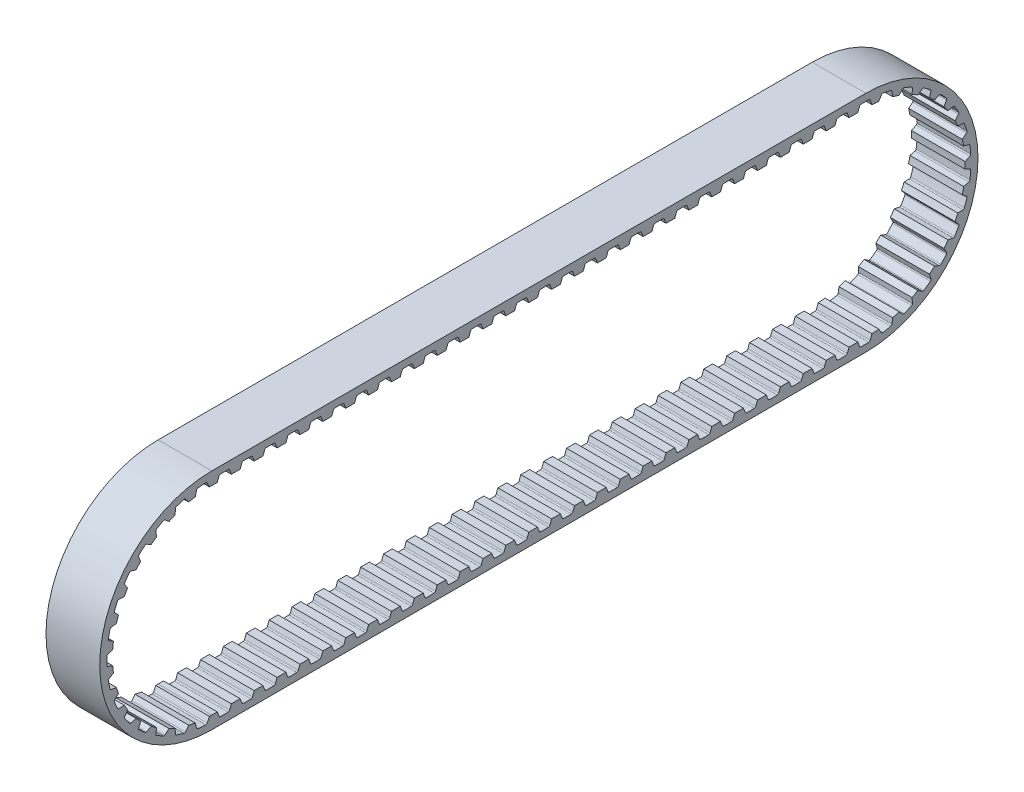
from build123d import *

# Parameters (mm, degrees)
SKETCH_2_W            = 4.8
SKETCH_2_H            = 1.14
CUT_EXTRUDE_1_DEPTH   = 70.216581626
PATTERN_START         = -2.4
PATTERN_CURVE_1_DEPTH = 4.8


with BuildPart() as part:
    # 扫描1: sweep along a path in 草图1
    with BuildLine(Plane(origin=(0, 0, 0), x_dir=(0, 0, -1), z_dir=(1, 0, 0))) as sweep_1_path:
        Line((0, 10.016), (58.43, 10.016))
        ThreePointArc((58.43, 10.016), (68.446, 0), (58.43, -10.016))
        Line((58.43, -10.016), (0, -10.016))
        ThreePointArc((0, -10.016), (-10.016, 0), (0, 10.016))
    # 草图2 → 扫描1 (sweep)
    with BuildSketch(Plane.XY):
        with Locations((0, 9.446)):
            Rectangle(SKETCH_2_W, SKETCH_2_H)
    sweep(path=sweep_1_path.line)

    # 草图3 → 切除-拉伸1 (cut, symmetric)
    with BuildSketch(Plane(origin=(0, 0, 0), x_dir=(0, 0, -1), z_dir=(1, 0, 0))):
        with BuildLine():
            Line((-9.293707032, 0.475732932), (-7.602, 1.091463937))
            Line((-7.602, 1.091463937), (-7.602, -1.091463937))
            Line((-7.602, -1.091463937), (-9.293707032, -0.475732932))
            ThreePointArc((-9.293707032, -0.475732932), (-9.354290321, -0.430158511), (-9.379149531, -0.358538803))
            ThreePointArc((-9.379149531, -0.358538803), (-9.386, 0), (-9.379149531, 0.358538803))
            ThreePointArc((-9.379149531, 0.358538803), (-9.354290321, 0.430158511), (-9.293707032, 0.475732932))
        make_face()
    extrude(amount=CUT_EXTRUDE_1_DEPTH, both=True, mode=Mode.SUBTRACT)

    # 曲线阵列1: read off the stored shape, not the designer's step
    # 曲线阵列1 outline → 曲线阵列1 (cut)
    with BuildSketch(Plane.YZ.offset(PATTERN_START)):
        with BuildLine():
            ThreePointArc((2.408909246, 8.98868558), (2.377013143, 9.057460587), (2.312176357, 9.096748677))
            ThreePointArc((2.312176357, 9.096748677), (1.962999192, 9.178432882), (1.610956596, 9.24671914))
            ThreePointArc((1.610956596, 9.24671914), (1.535721641, 9.237388311), (1.478484616, 9.187676281))
            Line((1.478484616, 9.187676281), (1.229559122, 8.790424357))
            ThreePointArc((1.229559122, 8.790424357), (1.856337186, 8.6797113), (2.47356987, 8.524366728))
            Line((2.47356987, 8.524366728), (2.408909246, 8.98868558))
        make_face()
        with BuildLine():
            Line((-2.408909246, 8.98868558), (-2.47356987, 8.524366728))
            ThreePointArc((-2.47356987, 8.524366728), (-1.856337186, 8.6797113), (-1.229559122, 8.790424357))
            Line((-1.229559122, 8.790424357), (-1.478484616, 9.187676281))
            ThreePointArc((-1.478484616, 9.187676281), (-1.535721641, 9.237388311), (-1.610956596, 9.24671914))
            ThreePointArc((-1.610956596, 9.24671914), (-1.962999192, 9.178432882), (-2.312176357, 9.096748677))
            ThreePointArc((-2.312176357, 9.096748677), (-2.377013143, 9.057460587), (-2.408909246, 8.98868558))
        make_face()
        with BuildLine():
            Line((-4.235541696, 8.286102748), (-4.201664183, 7.818528896))
            ThreePointArc((-4.201664183, 7.818528896), (-3.630570268, 8.099526871), (-3.040807775, 8.338876668))
            Line((-3.040807775, 8.338876668), (-3.367310135, 8.675282973))
            ThreePointArc((-3.367310135, 8.675282973), (-3.433678222, 8.711925024), (-3.509200851, 8.705314778))
            ThreePointArc((-3.509200851, 8.705314778), (-3.839176716, 8.564912034), (-4.163548456, 8.41200691))
            ThreePointArc((-4.163548456, 8.41200691), (-4.218734648, 8.360027615), (-4.235541696, 8.286102748))
        make_face()
        with BuildLine():
            Line((-5.874839993, 7.217033135), (-5.743922715, 6.766884649))
            ThreePointArc((-5.743922715, 6.766884649), (-5.244226532, 7.161107742), (-4.717564269, 7.518508055))
            Line((-4.717564269, 7.518508055), (-5.107202592, 7.779189797))
            ThreePointArc((-5.107202592, 7.779189797), (-5.179766341, 7.801141225), (-5.252236347, 7.778882269))
            ThreePointArc((-5.252236347, 7.778882269), (-5.545550949, 7.572572923), (-5.830770596, 7.355209735))
            ThreePointArc((-5.830770596, 7.355209735), (-5.87386536, 7.292838234), (-5.874839993, 7.217033135))
        make_face()
        with BuildLine():
            Line((-7.254299465, 5.828760716), (-7.032132774, 5.415947254))
            ThreePointArc((-7.032132774, 5.415947254), (-6.62593543, 5.905959336), (-6.18566719, 6.365602675))
            Line((-6.18566719, 6.365602675), (-6.621208128, 6.539030137))
            ThreePointArc((-6.621208128, 6.539030137), (-6.696758111, 6.545320051), (-6.762970211, 6.508396878))
            ThreePointArc((-6.762970211, 6.508396878), (-7.006650512, 6.245305805), (-7.240103062, 5.97309833))
            ThreePointArc((-7.240103062, 5.97309833), (-7.269200354, 5.903093255), (-7.254299465, 5.828760716))
        make_face()
        with BuildLine():
            Line((-8.312907876, 4.182687517), (-8.009318002, 3.825467442))
            ThreePointArc((-8.009318002, 3.825467442), (-7.714585237, 4.389595725), (-7.380183683, 4.931152483))
            Line((-7.380183683, 4.931152483), (-7.842363656, 5.009655127))
            ThreePointArc((-7.842363656, 5.009655127), (-7.917558365, 5.000005329), (-7.974584059, 4.950051018))
            ThreePointArc((-7.974584059, 4.950051018), (-8.157852302, 4.641814497), (-8.329212359, 4.326802223))
            ThreePointArc((-8.329212359, 4.326802223), (-8.343025234, 4.252259837), (-8.312907876, 4.182687517))
        make_face()
        with BuildLine():
            Line((-9.003843939, 2.351617856), (-8.632258386, 2.065790688))
            ThreePointArc((-8.632258386, 2.065790688), (-8.462025961, 2.679084291), (-8.248281369, 3.278601907))
            Line((-8.248281369, 3.278601907), (-8.716658579, 3.258707632))
            ThreePointArc((-8.716658579, 3.258707632), (-8.788172221, 3.233544924), (-8.833489314, 3.172768908))
            ThreePointArc((-8.833489314, 3.172768908), (-8.94823971, 2.833019959), (-9.049928177, 2.489135592))
            ThreePointArc((-9.049928177, 2.489135592), (-9.047845702, 2.413352836), (-9.003843939, 2.351617856))
        make_face()
        with BuildLine():
            Line((-9.296548181, 0.416538279), (-8.873401839, 0.214745892))
            ThreePointArc((-8.873401839, 0.214745892), (-8.83519898, 0.850079398), (-8.751565079, 1.481041753))
            Line((-8.751565079, 1.481041753), (-9.205423628, 1.363630464))
            ThreePointArc((-9.205423628, 1.363630464), (-9.27009322, 1.32406777), (-9.301697377, 1.255158118))
            ThreePointArc((-9.301697377, 1.255158118), (-9.342854622, 0.898923528), (-9.370373909, 0.54137676))
            ThreePointArc((-9.370373909, 0.54137676), (-9.352488192, 0.467705436), (-9.296548181, 0.416538279))
        make_face()
        with BuildLine():
            Line((-9.293707032, -1.589068101), (-8.876, -1.741101027))
            Line((-8.876, -1.741101027), (-8.876, -0.48556931))
            Line((-8.876, -0.48556931), (-9.293707032, -0.637602236))
            ThreePointArc((-9.293707032, -0.637602236), (-9.354290321, -0.683176657), (-9.379149531, -0.754796365))
            ThreePointArc((-9.379149531, -0.754796365), (-9.386, -1.113335168), (-9.379149531, -1.471873971))
            ThreePointArc((-9.379149531, -1.471873971), (-9.354290321, -1.543493679), (-9.293707032, -1.589068101))
        make_face()
        with BuildLine():
            Line((-9.293707032, -3.632825543), (-8.876, -3.784858469))
            Line((-8.876, -3.784858469), (-8.876, -2.529326752))
            Line((-8.876, -2.529326752), (-9.293707032, -2.681359678))
            ThreePointArc((-9.293707032, -2.681359678), (-9.354290321, -2.7269341), (-9.379149531, -2.798553808))
            ThreePointArc((-9.379149531, -2.798553808), (-9.386, -3.157092611), (-9.379149531, -3.515631414))
            ThreePointArc((-9.379149531, -3.515631414), (-9.354290321, -3.587251122), (-9.293707032, -3.632825543))
        make_face()
        with BuildLine():
            Line((-9.293707032, -5.676582985), (-8.876, -5.828615911))
            Line((-8.876, -5.828615911), (-8.876, -4.573084195))
            Line((-8.876, -4.573084195), (-9.293707032, -4.725117121))
            ThreePointArc((-9.293707032, -4.725117121), (-9.354290321, -4.770691542), (-9.379149531, -4.84231125))
            ThreePointArc((-9.379149531, -4.84231125), (-9.386, -5.200850053), (-9.379149531, -5.559388856))
            ThreePointArc((-9.379149531, -5.559388856), (-9.354290321, -5.631008564), (-9.293707032, -5.676582985))
        make_face()
        with BuildLine():
            Line((-9.293707032, -7.720340428), (-8.876, -7.872373354))
            Line((-8.876, -7.872373354), (-8.876, -6.616841637))
            Line((-8.876, -6.616841637), (-9.293707032, -6.768874563))
            ThreePointArc((-9.293707032, -6.768874563), (-9.354290321, -6.814448984), (-9.379149531, -6.886068692))
            ThreePointArc((-9.379149531, -6.886068692), (-9.386, -7.244607495), (-9.379149531, -7.603146298))
            ThreePointArc((-9.379149531, -7.603146298), (-9.354290321, -7.674766006), (-9.293707032, -7.720340428))
        make_face()
        with BuildLine():
            Line((-9.293707032, -9.76409787), (-8.876, -9.916130796))
            Line((-8.876, -9.916130796), (-8.876, -8.660599079))
            Line((-8.876, -8.660599079), (-9.293707032, -8.812632005))
            ThreePointArc((-9.293707032, -8.812632005), (-9.354290321, -8.858206427), (-9.379149531, -8.929826135))
            ThreePointArc((-9.379149531, -8.929826135), (-9.386, -9.288364938), (-9.379149531, -9.646903741))
            ThreePointArc((-9.379149531, -9.646903741), (-9.354290321, -9.718523449), (-9.293707032, -9.76409787))
        make_face()
        with BuildLine():
            Line((-9.293707032, -11.807855312), (-8.876, -11.959888238))
            Line((-8.876, -11.959888238), (-8.876, -10.704356522))
            Line((-8.876, -10.704356522), (-9.293707032, -10.856389448))
            ThreePointArc((-9.293707032, -10.856389448), (-9.354290321, -10.901963869), (-9.379149531, -10.973583577))
            ThreePointArc((-9.379149531, -10.973583577), (-9.386, -11.33212238), (-9.379149531, -11.690661183))
            ThreePointArc((-9.379149531, -11.690661183), (-9.354290321, -11.762280891), (-9.293707032, -11.807855312))
        make_face()
        with BuildLine():
            Line((-9.293707032, -13.851612754), (-8.876, -14.003645681))
            Line((-8.876, -14.003645681), (-8.876, -12.748113964))
            Line((-8.876, -12.748113964), (-9.293707032, -12.90014689))
            ThreePointArc((-9.293707032, -12.90014689), (-9.354290321, -12.945721311), (-9.379149531, -13.017341019))
            ThreePointArc((-9.379149531, -13.017341019), (-9.386, -13.375879822), (-9.379149531, -13.734418625))
            ThreePointArc((-9.379149531, -13.734418625), (-9.354290321, -13.806038333), (-9.293707032, -13.851612754))
        make_face()
        with BuildLine():
            Line((-9.293707032, -15.895370197), (-8.876, -16.047403123))
            Line((-8.876, -16.047403123), (-8.876, -14.791871406))
            Line((-8.876, -14.791871406), (-9.293707032, -14.943904332))
            ThreePointArc((-9.293707032, -14.943904332), (-9.354290321, -14.989478754), (-9.379149531, -15.061098462))
            ThreePointArc((-9.379149531, -15.061098462), (-9.386, -15.419637265), (-9.379149531, -15.778176067))
            ThreePointArc((-9.379149531, -15.778176067), (-9.354290322, -15.849795775), (-9.293707032, -15.895370197))
        make_face()
        with BuildLine():
            Line((-9.293707032, -17.939127639), (-8.876, -18.091160565))
            Line((-8.876, -18.091160565), (-8.876, -16.835628848))
            Line((-8.876, -16.835628848), (-9.293707032, -16.987661775))
            ThreePointArc((-9.293707032, -16.987661775), (-9.354290321, -17.033236196), (-9.379149531, -17.104855904))
            ThreePointArc((-9.379149531, -17.104855904), (-9.386, -17.463394707), (-9.379149531, -17.82193351))
            ThreePointArc((-9.379149531, -17.82193351), (-9.354290321, -17.893553218), (-9.293707032, -17.939127639))
        make_face()
        with BuildLine():
            Line((-9.293707032, -19.982885081), (-8.876, -20.134918007))
            Line((-8.876, -20.134918007), (-8.876, -18.879386291))
            Line((-8.876, -18.879386291), (-9.293707032, -19.031419217))
            ThreePointArc((-9.293707032, -19.031419217), (-9.354290321, -19.076993638), (-9.379149531, -19.148613346))
            ThreePointArc((-9.379149531, -19.148613346), (-9.386, -19.507152149), (-9.379149531, -19.865690952))
            ThreePointArc((-9.379149531, -19.865690952), (-9.354290321, -19.93731066), (-9.293707032, -19.982885081))
        make_face()
        with BuildLine():
            Line((-9.293707032, -22.026642524), (-8.876, -22.17867545))
            Line((-8.876, -22.17867545), (-8.876, -20.923143733))
            Line((-8.876, -20.923143733), (-9.293707032, -21.075176659))
            ThreePointArc((-9.293707032, -21.075176659), (-9.354290321, -21.12075108), (-9.379149531, -21.192370788))
            ThreePointArc((-9.379149531, -21.192370788), (-9.386, -21.550909591), (-9.379149531, -21.909448394))
            ThreePointArc((-9.379149531, -21.909448394), (-9.354290321, -21.981068102), (-9.293707032, -22.026642524))
        make_face()
        with BuildLine():
            Line((-9.293707032, -24.070399966), (-8.876, -24.222432892))
            Line((-8.876, -24.222432892), (-8.876, -22.966901175))
            Line((-8.876, -22.966901175), (-9.293707032, -23.118934101))
            ThreePointArc((-9.293707032, -23.118934101), (-9.354290321, -23.164508523), (-9.379149531, -23.236128231))
            ThreePointArc((-9.379149531, -23.236128231), (-9.386, -23.594667034), (-9.379149531, -23.953205837))
            ThreePointArc((-9.379149531, -23.953205837), (-9.354290321, -24.024825545), (-9.293707032, -24.070399966))
        make_face()
        with BuildLine():
            Line((-9.293707032, -26.114157408), (-8.876, -26.266190334))
            Line((-8.876, -26.266190334), (-8.876, -25.010658618))
            Line((-8.876, -25.010658618), (-9.293707032, -25.162691544))
            ThreePointArc((-9.293707032, -25.162691544), (-9.354290321, -25.208265965), (-9.379149531, -25.279885673))
            ThreePointArc((-9.379149531, -25.279885673), (-9.386, -25.638424476), (-9.379149531, -25.996963279))
            ThreePointArc((-9.379149531, -25.996963279), (-9.354290321, -26.068582987), (-9.293707032, -26.114157408))
        make_face()
        with BuildLine():
            Line((-9.293707032, -28.157914851), (-8.876, -28.309947777))
            Line((-8.876, -28.309947777), (-8.876, -27.05441606))
            Line((-8.876, -27.05441606), (-9.293707032, -27.206448986))
            ThreePointArc((-9.293707032, -27.206448986), (-9.354290321, -27.252023407), (-9.379149531, -27.323643115))
            ThreePointArc((-9.379149531, -27.323643115), (-9.386, -27.682181918), (-9.379149531, -28.040720721))
            ThreePointArc((-9.379149531, -28.040720721), (-9.354290321, -28.112340429), (-9.293707032, -28.157914851))
        make_face()
        with BuildLine():
            Line((-9.293707032, -30.201672293), (-8.876, -30.353705219))
            Line((-8.876, -30.353705219), (-8.876, -29.098173502))
            Line((-8.876, -29.098173502), (-9.293707032, -29.250206428))
            ThreePointArc((-9.293707032, -29.250206428), (-9.354290321, -29.29578085), (-9.379149531, -29.367400558))
            ThreePointArc((-9.379149531, -29.367400558), (-9.386, -29.725939361), (-9.379149531, -30.084478164))
            ThreePointArc((-9.379149531, -30.084478164), (-9.354290321, -30.156097872), (-9.293707032, -30.201672293))
        make_face()
        with BuildLine():
            Line((-9.293707032, -32.245429735), (-8.876, -32.397462661))
            Line((-8.876, -32.397462661), (-8.876, -31.141930944))
            Line((-8.876, -31.141930944), (-9.293707032, -31.293963871))
            ThreePointArc((-9.293707032, -31.293963871), (-9.354290321, -31.339538292), (-9.379149531, -31.411158))
            ThreePointArc((-9.379149531, -31.411158), (-9.386, -31.769696803), (-9.379149531, -32.128235606))
            ThreePointArc((-9.379149531, -32.128235606), (-9.354290321, -32.199855314), (-9.293707032, -32.245429735))
        make_face()
        with BuildLine():
            Line((-9.293707032, -34.289187177), (-8.876, -34.441220104))
            Line((-8.876, -34.441220104), (-8.876, -33.185688387))
            Line((-8.876, -33.185688387), (-9.293707032, -33.337721313))
            ThreePointArc((-9.293707032, -33.337721313), (-9.354290321, -33.383295734), (-9.379149531, -33.454915442))
            ThreePointArc((-9.379149531, -33.454915442), (-9.386, -33.813454245), (-9.379149531, -34.171993048))
            ThreePointArc((-9.379149531, -34.171993048), (-9.354290321, -34.243612756), (-9.293707032, -34.289187177))
        make_face()
        with BuildLine():
            Line((-9.293707032, -36.33294462), (-8.876, -36.484977546))
            Line((-8.876, -36.484977546), (-8.876, -35.229445829))
            Line((-8.876, -35.229445829), (-9.293707032, -35.381478755))
            ThreePointArc((-9.293707032, -35.381478755), (-9.354290322, -35.427053177), (-9.379149531, -35.498672885))
            ThreePointArc((-9.379149531, -35.498672885), (-9.386, -35.857211687), (-9.379149531, -36.21575049))
            ThreePointArc((-9.379149531, -36.21575049), (-9.354290321, -36.287370198), (-9.293707032, -36.33294462))
        make_face()
        with BuildLine():
            Line((-9.293707032, -38.376702062), (-8.876, -38.528734988))
            Line((-8.876, -38.528734988), (-8.876, -37.273203271))
            Line((-8.876, -37.273203271), (-9.293707032, -37.425236197))
            ThreePointArc((-9.293707032, -37.425236197), (-9.354290321, -37.470810619), (-9.379149531, -37.542430327))
            ThreePointArc((-9.379149531, -37.542430327), (-9.386, -37.90096913), (-9.379149531, -38.259507933))
            ThreePointArc((-9.379149531, -38.259507933), (-9.354290321, -38.331127641), (-9.293707032, -38.376702062))
        make_face()
        with BuildLine():
            Line((-9.293707032, -40.420459504), (-8.876, -40.57249243))
            Line((-8.876, -40.57249243), (-8.876, -39.316960714))
            Line((-8.876, -39.316960714), (-9.293707032, -39.46899364))
            ThreePointArc((-9.293707032, -39.46899364), (-9.354290321, -39.514568061), (-9.379149531, -39.586187769))
            ThreePointArc((-9.379149531, -39.586187769), (-9.386, -39.944726572), (-9.379149531, -40.303265375))
            ThreePointArc((-9.379149531, -40.303265375), (-9.354290321, -40.374885083), (-9.293707032, -40.420459504))
        make_face()
        with BuildLine():
            Line((-9.293707032, -42.464216947), (-8.876, -42.616249873))
            Line((-8.876, -42.616249873), (-8.876, -41.360718156))
            Line((-8.876, -41.360718156), (-9.293707032, -41.512751082))
            ThreePointArc((-9.293707032, -41.512751082), (-9.354290321, -41.558325503), (-9.379149531, -41.629945211))
            ThreePointArc((-9.379149531, -41.629945211), (-9.386, -41.988484014), (-9.379149531, -42.347022817))
            ThreePointArc((-9.379149531, -42.347022817), (-9.354290321, -42.418642525), (-9.293707032, -42.464216947))
        make_face()
        with BuildLine():
            Line((-9.293707032, -44.507974389), (-8.876, -44.660007315))
            Line((-8.876, -44.660007315), (-8.876, -43.404475598))
            Line((-8.876, -43.404475598), (-9.293707032, -43.556508524))
            ThreePointArc((-9.293707032, -43.556508524), (-9.354290321, -43.602082946), (-9.379149531, -43.673702654))
            ThreePointArc((-9.379149531, -43.673702654), (-9.386, -44.032241457), (-9.379149531, -44.39078026))
            ThreePointArc((-9.379149531, -44.39078026), (-9.354290321, -44.462399968), (-9.293707032, -44.507974389))
        make_face()
        with BuildLine():
            Line((-9.293707032, -46.551731831), (-8.876, -46.703764757))
            Line((-8.876, -46.703764757), (-8.876, -45.448233041))
            Line((-8.876, -45.448233041), (-9.293707032, -45.600265967))
            ThreePointArc((-9.293707032, -45.600265967), (-9.354290321, -45.645840388), (-9.379149531, -45.717460096))
            ThreePointArc((-9.379149531, -45.717460096), (-9.386, -46.075998899), (-9.379149531, -46.434537702))
            ThreePointArc((-9.379149531, -46.434537702), (-9.354290321, -46.50615741), (-9.293707032, -46.551731831))
        make_face()
        with BuildLine():
            Line((-9.293707032, -48.595489273), (-8.876, -48.7475222))
            Line((-8.876, -48.7475222), (-8.876, -47.491990483))
            Line((-8.876, -47.491990483), (-9.293707032, -47.644023409))
            ThreePointArc((-9.293707032, -47.644023409), (-9.354290321, -47.68959783), (-9.379149531, -47.761217538))
            ThreePointArc((-9.379149531, -47.761217538), (-9.386, -48.119756341), (-9.379149531, -48.478295144))
            ThreePointArc((-9.379149531, -48.478295144), (-9.354290321, -48.549914852), (-9.293707032, -48.595489273))
        make_face()
        with BuildLine():
            Line((-9.293707032, -50.639246716), (-8.876, -50.791279642))
            Line((-8.876, -50.791279642), (-8.876, -49.535747925))
            Line((-8.876, -49.535747925), (-9.293707032, -49.687780851))
            ThreePointArc((-9.293707032, -49.687780851), (-9.354290321, -49.733355273), (-9.379149531, -49.804974981))
            ThreePointArc((-9.379149531, -49.804974981), (-9.386, -50.163513784), (-9.379149531, -50.522052586))
            ThreePointArc((-9.379149531, -50.522052586), (-9.354290322, -50.593672294), (-9.293707032, -50.639246716))
        make_face()
        with BuildLine():
            Line((-9.293707032, -52.683004158), (-8.876, -52.835037084))
            Line((-8.876, -52.835037084), (-8.876, -51.579505367))
            Line((-8.876, -51.579505367), (-9.293707032, -51.731538294))
            ThreePointArc((-9.293707032, -51.731538294), (-9.354290321, -51.777112715), (-9.379149531, -51.848732423))
            ThreePointArc((-9.379149531, -51.848732423), (-9.386, -52.207271226), (-9.379149531, -52.565810029))
            ThreePointArc((-9.379149531, -52.565810029), (-9.354290321, -52.637429737), (-9.293707032, -52.683004158))
        make_face()
        with BuildLine():
            Line((-9.293707032, -54.7267616), (-8.876, -54.878794527))
            Line((-8.876, -54.878794527), (-8.876, -53.62326281))
            Line((-8.876, -53.62326281), (-9.293707032, -53.775295736))
            ThreePointArc((-9.293707032, -53.775295736), (-9.354290321, -53.820870157), (-9.379149531, -53.892489865))
            ThreePointArc((-9.379149531, -53.892489865), (-9.386, -54.251028668), (-9.379149531, -54.609567471))
            ThreePointArc((-9.379149531, -54.609567471), (-9.354290321, -54.681187179), (-9.293707032, -54.7267616))
        make_face()
        with BuildLine():
            Line((-9.293707032, -56.770519043), (-8.876, -56.922551969))
            Line((-8.876, -56.922551969), (-8.876, -55.667020252))
            Line((-8.876, -55.667020252), (-9.293707032, -55.819053178))
            ThreePointArc((-9.293707032, -55.819053178), (-9.354290321, -55.864627599), (-9.379149531, -55.936247307))
            ThreePointArc((-9.379149531, -55.936247307), (-9.386, -56.29478611), (-9.379149531, -56.653324913))
            ThreePointArc((-9.379149531, -56.653324913), (-9.354290321, -56.724944621), (-9.293707032, -56.770519043))
        make_face()
        with BuildLine():
            Line((-9.293707032, -58.814276485), (-8.859415163, -58.972345798))
            ThreePointArc((-8.859415163, -58.972345798), (-8.871852822, -58.70129966), (-8.876, -58.43))
            Line((-8.876, -58.43), (-8.876, -57.710777694))
            Line((-8.876, -57.710777694), (-9.293707032, -57.86281062))
            ThreePointArc((-9.293707032, -57.86281062), (-9.354290321, -57.908385042), (-9.379149531, -57.98000475))
            ThreePointArc((-9.379149531, -57.98000475), (-9.386, -58.338543553), (-9.379149531, -58.697082356))
            ThreePointArc((-9.379149531, -58.697082356), (-9.354290321, -58.768702064), (-9.293707032, -58.814276485))
        make_face()
        with BuildLine():
            Line((-9.010998115, -60.754053611), (-8.547309544, -60.823089126))
            ThreePointArc((-8.547309544, -60.823089126), (-8.69682772, -60.204419232), (-8.801626366, -59.576625185))
            Line((-8.801626366, -59.576625185), (-9.201207593, -59.82179418))
            ThreePointArc((-9.201207593, -59.82179418), (-9.251457064, -59.878559958), (-9.26149682, -59.953703595))
            ThreePointArc((-9.26149682, -59.953703595), (-9.196532783, -60.306374371), (-9.118144376, -60.656306164))
            ThreePointArc((-9.118144376, -60.656306164), (-9.079469337, -60.72151049), (-9.010998115, -60.754053611))
        make_face()
        with BuildLine():
            Line((-8.32566866, -62.587229075), (-7.857796181, -62.557761522))
            ThreePointArc((-7.857796181, -62.557761522), (-8.133397187, -61.98404364), (-8.367175852, -61.392050686))
            Line((-8.367175852, -61.392050686), (-8.706645587, -61.715366774))
            ThreePointArc((-8.706645587, -61.715366774), (-8.743911751, -61.781386436), (-8.738013854, -61.856968032))
            ThreePointArc((-8.738013854, -61.856968032), (-8.600728481, -62.188252998), (-8.450888447, -62.514051965))
            ThreePointArc((-8.450888447, -62.514051965), (-8.399431778, -62.569725784), (-8.32566866, -62.587229075))
        make_face()
        with BuildLine():
            Line((-7.272102459, -64.236534081), (-6.820739646, -64.109866784))
            ThreePointArc((-6.820739646, -64.109866784), (-7.210233901, -63.606475934), (-7.562652766, -63.076467382))
            Line((-7.562652766, -63.076467382), (-7.826996572, -63.463630585))
            ThreePointArc((-7.826996572, -63.463630585), (-7.849631182, -63.535984143), (-7.828056488, -63.608660793))
            ThreePointArc((-7.828056488, -63.608660793), (-7.624521788, -63.903907517), (-7.409857416, -64.191163865))
            ThreePointArc((-7.409857416, -64.191163865), (-7.347894999, -64.234844774), (-7.272102459, -64.236534081))
        make_face()
        with BuildLine():
            Line((-5.896897786, -65.629021372), (-5.482008005, -65.410756709))
            ThreePointArc((-5.482008005, -65.410756709), (-5.968168532, -64.99995741), (-6.423640434, -64.555375056))
            Line((-6.423640434, -64.555375056), (-6.601166624, -64.989261499))
            ThreePointArc((-6.601166624, -64.989261499), (-6.608168571, -65.06474882), (-6.571871311, -65.131306102))
            ThreePointArc((-6.571871311, -65.131306102), (-6.311089437, -65.377456089), (-6.041095136, -65.613464732))
            ThreePointArc((-6.041095136, -65.613464732), (-5.971367513, -65.643220764), (-5.896897786, -65.629021372))
        make_face()
        with BuildLine():
            Line((-4.260878693, -66.7031025), (-3.900812141, -66.402894119))
            ThreePointArc((-3.900812141, -66.402894119), (-4.462136503, -66.10285565), (-5.000516333, -65.763362967))
            Line((-5.000516333, -65.763362967), (-5.083373086, -66.224782247))
            ThreePointArc((-5.083373086, -66.224782247), (-5.07443268, -66.300064596), (-5.025018248, -66.357558742))
            ThreePointArc((-5.025018248, -66.357558742), (-4.718523346, -66.543725004), (-4.405140718, -66.718047494))
            ThreePointArc((-4.405140718, -66.718047494), (-4.330731877, -66.732562566), (-4.260878693, -66.7031025))
        make_face()
        with BuildLine():
            Line((-2.436404814, -67.411271836), (-2.147086907, -67.042397681))
            ThreePointArc((-2.147086907, -67.042397681), (-2.758748238, -66.86639047), (-3.356223946, -66.64700291))
            Line((-3.356223946, -66.64700291), (-3.340746584, -67.115546872))
            ThreePointArc((-3.340746584, -67.115546872), (-3.316259251, -67.187294579), (-3.255913203, -67.233182675))
            ThreePointArc((-3.255913203, -67.233182675), (-2.917261263, -67.351131247), (-2.574350936, -67.456057459))
            ThreePointArc((-2.574350936, -67.456057459), (-2.498551914, -67.454689585), (-2.436404814, -67.411271836))
        make_face()
        with BuildLine():
            Line((-0.504170968, -67.722207695), (-0.298397974, -67.300982733))
            ThreePointArc((-0.298397974, -67.300982733), (-0.933343051, -67.256791419), (-1.56348883, -67.167212294))
            Line((-1.56348883, -67.167212294), (-1.450361901, -67.622157667))
            ThreePointArc((-1.450361901, -67.622157667), (-1.411410693, -67.687197396), (-1.34280208, -67.719449853))
            ThreePointArc((-1.34280208, -67.719449853), (-0.986971369, -67.763963977), (-0.629699956, -67.79485312))
            ThreePointArc((-0.629699956, -67.79485312), (-0.555863273, -67.777662798), (-0.504170968, -67.722207695))
        make_face()
        with BuildLine():
            Line((1.450361901, -67.622157667), (1.56348883, -67.167212294))
            ThreePointArc((1.56348883, -67.167212294), (0.933343051, -67.256791419), (0.298397974, -67.300982733))
            Line((0.298397974, -67.300982733), (0.504170968, -67.722207695))
            ThreePointArc((0.504170968, -67.722207695), (0.555863273, -67.777662798), (0.629699956, -67.79485312))
            ThreePointArc((0.629699956, -67.79485312), (0.986971369, -67.763963977), (1.34280208, -67.719449853))
            ThreePointArc((1.34280208, -67.719449853), (1.411410693, -67.687197396), (1.450361901, -67.622157667))
        make_face()
        with BuildLine():
            Line((3.340746584, -67.115546872), (3.356223946, -66.64700291))
            ThreePointArc((3.356223946, -66.64700291), (2.758748238, -66.86639047), (2.147086907, -67.042397681))
            Line((2.147086907, -67.042397681), (2.436404814, -67.411271836))
            ThreePointArc((2.436404814, -67.411271836), (2.498551914, -67.454689585), (2.574350936, -67.456057459))
            ThreePointArc((2.574350936, -67.456057459), (2.917261263, -67.351131247), (3.255913203, -67.233182675))
            ThreePointArc((3.255913203, -67.233182675), (3.316259251, -67.187294579), (3.340746584, -67.115546872))
        make_face()
        with BuildLine():
            Line((5.083373086, -66.224782247), (5.000516333, -65.763362967))
            ThreePointArc((5.000516333, -65.763362967), (4.462136503, -66.10285565), (3.900812141, -66.402894119))
            Line((3.900812141, -66.402894119), (4.260878693, -66.7031025))
            ThreePointArc((4.260878693, -66.7031025), (4.330731877, -66.732562566), (4.405140718, -66.718047494))
            ThreePointArc((4.405140718, -66.718047494), (4.718523346, -66.543725004), (5.025018248, -66.357558742))
            ThreePointArc((5.025018248, -66.357558742), (5.07443268, -66.300064596), (5.083373086, -66.224782247))
        make_face()
        with BuildLine():
            Line((6.601166624, -64.989261499), (6.423640434, -64.555375056))
            ThreePointArc((6.423640434, -64.555375056), (5.968168532, -64.99995741), (5.482008005, -65.410756709))
            Line((5.482008005, -65.410756709), (5.896897786, -65.629021372))
            ThreePointArc((5.896897786, -65.629021372), (5.971367513, -65.643220764), (6.041095136, -65.613464732))
            ThreePointArc((6.041095136, -65.613464732), (6.311089437, -65.377456089), (6.571871311, -65.131306102))
            ThreePointArc((6.571871311, -65.131306102), (6.608168571, -65.06474882), (6.601166624, -64.989261499))
        make_face()
        with BuildLine():
            Line((7.826996572, -63.463630585), (7.562652766, -63.076467382))
            ThreePointArc((7.562652766, -63.076467382), (7.210233901, -63.606475934), (6.820739646, -64.109866784))
            Line((6.820739646, -64.109866784), (7.272102459, -64.236534081))
            ThreePointArc((7.272102459, -64.236534081), (7.347894999, -64.234844774), (7.409857416, -64.191163865))
            ThreePointArc((7.409857416, -64.191163865), (7.624521788, -63.903907517), (7.828056488, -63.608660793))
            ThreePointArc((7.828056488, -63.608660793), (7.849631182, -63.535984143), (7.826996572, -63.463630585))
        make_face()
        with BuildLine():
            Line((8.706645587, -61.715366774), (8.367175852, -61.392050686))
            ThreePointArc((8.367175852, -61.392050686), (8.133397187, -61.98404364), (7.857796181, -62.557761522))
            Line((7.857796181, -62.557761522), (8.32566866, -62.587229075))
            ThreePointArc((8.32566866, -62.587229075), (8.399431778, -62.569725784), (8.450888447, -62.514051965))
            ThreePointArc((8.450888447, -62.514051965), (8.600728481, -62.188252998), (8.738013854, -61.856968032))
            ThreePointArc((8.738013854, -61.856968032), (8.743911751, -61.781386436), (8.706645587, -61.715366774))
        make_face()
        with BuildLine():
            Line((9.201207593, -59.82179418), (8.801626366, -59.576625185))
            ThreePointArc((8.801626366, -59.576625185), (8.69682772, -60.204419232), (8.547309544, -60.823089126))
            Line((8.547309544, -60.823089126), (9.010998115, -60.754053611))
            ThreePointArc((9.010998115, -60.754053611), (9.079469337, -60.72151049), (9.118144376, -60.656306164))
            ThreePointArc((9.118144376, -60.656306164), (9.196532783, -60.306374371), (9.26149682, -59.953703595))
            ThreePointArc((9.26149682, -59.953703595), (9.251457064, -59.878559958), (9.201207593, -59.82179418))
        make_face()
        with BuildLine():
            Line((9.293707032, -57.86281062), (8.876, -57.710777694))
            Line((8.876, -57.710777694), (8.876, -58.43))
            ThreePointArc((8.876, -58.43), (8.871852822, -58.70129966), (8.859415163, -58.972345798))
            Line((8.859415163, -58.972345798), (9.293707032, -58.814276485))
            ThreePointArc((9.293707032, -58.814276485), (9.354290321, -58.768702064), (9.379149531, -58.697082356))
            ThreePointArc((9.379149531, -58.697082356), (9.386, -58.338543553), (9.379149531, -57.98000475))
            ThreePointArc((9.379149531, -57.98000475), (9.354290321, -57.908385042), (9.293707032, -57.86281062))
        make_face()
        with BuildLine():
            Line((9.293707032, -55.819053178), (8.876, -55.667020252))
            Line((8.876, -55.667020252), (8.876, -56.922551969))
            Line((8.876, -56.922551969), (9.293707032, -56.770519043))
            ThreePointArc((9.293707032, -56.770519043), (9.354290321, -56.724944621), (9.379149531, -56.653324913))
            ThreePointArc((9.379149531, -56.653324913), (9.386, -56.29478611), (9.379149531, -55.936247307))
            ThreePointArc((9.379149531, -55.936247307), (9.354290321, -55.864627599), (9.293707032, -55.819053178))
        make_face()
        with BuildLine():
            Line((9.293707032, -53.775295736), (8.876, -53.62326281))
            Line((8.876, -53.62326281), (8.876, -54.878794527))
            Line((8.876, -54.878794527), (9.293707032, -54.7267616))
            ThreePointArc((9.293707032, -54.7267616), (9.354290321, -54.681187179), (9.379149531, -54.609567471))
            ThreePointArc((9.379149531, -54.609567471), (9.386, -54.251028668), (9.379149531, -53.892489865))
            ThreePointArc((9.379149531, -53.892489865), (9.354290321, -53.820870157), (9.293707032, -53.775295736))
        make_face()
        with BuildLine():
            Line((9.293707032, -51.731538294), (8.876, -51.579505367))
            Line((8.876, -51.579505367), (8.876, -52.835037084))
            Line((8.876, -52.835037084), (9.293707032, -52.683004158))
            ThreePointArc((9.293707032, -52.683004158), (9.354290321, -52.637429737), (9.379149531, -52.565810029))
            ThreePointArc((9.379149531, -52.565810029), (9.386, -52.207271226), (9.379149531, -51.848732423))
            ThreePointArc((9.379149531, -51.848732423), (9.354290321, -51.777112715), (9.293707032, -51.731538294))
        make_face()
        with BuildLine():
            Line((9.293707032, -49.687780851), (8.876, -49.535747925))
            Line((8.876, -49.535747925), (8.876, -50.791279642))
            Line((8.876, -50.791279642), (9.293707032, -50.639246716))
            ThreePointArc((9.293707032, -50.639246716), (9.354290322, -50.593672294), (9.379149531, -50.522052586))
            ThreePointArc((9.379149531, -50.522052586), (9.386, -50.163513784), (9.379149531, -49.804974981))
            ThreePointArc((9.379149531, -49.804974981), (9.354290321, -49.733355273), (9.293707032, -49.687780851))
        make_face()
        with BuildLine():
            Line((9.293707032, -47.644023409), (8.876, -47.491990483))
            Line((8.876, -47.491990483), (8.876, -48.7475222))
            Line((8.876, -48.7475222), (9.293707032, -48.595489273))
            ThreePointArc((9.293707032, -48.595489273), (9.354290321, -48.549914852), (9.379149531, -48.478295144))
            ThreePointArc((9.379149531, -48.478295144), (9.386, -48.119756341), (9.379149531, -47.761217538))
            ThreePointArc((9.379149531, -47.761217538), (9.354290321, -47.68959783), (9.293707032, -47.644023409))
        make_face()
        with BuildLine():
            Line((9.293707032, -45.600265967), (8.876, -45.448233041))
            Line((8.876, -45.448233041), (8.876, -46.703764757))
            Line((8.876, -46.703764757), (9.293707032, -46.551731831))
            ThreePointArc((9.293707032, -46.551731831), (9.354290321, -46.50615741), (9.379149531, -46.434537702))
            ThreePointArc((9.379149531, -46.434537702), (9.386, -46.075998899), (9.379149531, -45.717460096))
            ThreePointArc((9.379149531, -45.717460096), (9.354290321, -45.645840388), (9.293707032, -45.600265967))
        make_face()
        with BuildLine():
            Line((9.293707032, -43.556508524), (8.876, -43.404475598))
            Line((8.876, -43.404475598), (8.876, -44.660007315))
            Line((8.876, -44.660007315), (9.293707032, -44.507974389))
            ThreePointArc((9.293707032, -44.507974389), (9.354290321, -44.462399968), (9.379149531, -44.39078026))
            ThreePointArc((9.379149531, -44.39078026), (9.386, -44.032241457), (9.379149531, -43.673702654))
            ThreePointArc((9.379149531, -43.673702654), (9.354290321, -43.602082946), (9.293707032, -43.556508524))
        make_face()
        with BuildLine():
            Line((9.293707032, -41.512751082), (8.876, -41.360718156))
            Line((8.876, -41.360718156), (8.876, -42.616249873))
            Line((8.876, -42.616249873), (9.293707032, -42.464216947))
            ThreePointArc((9.293707032, -42.464216947), (9.354290321, -42.418642525), (9.379149531, -42.347022817))
            ThreePointArc((9.379149531, -42.347022817), (9.386, -41.988484014), (9.379149531, -41.629945211))
            ThreePointArc((9.379149531, -41.629945211), (9.354290321, -41.558325503), (9.293707032, -41.512751082))
        make_face()
        with BuildLine():
            Line((9.293707032, -39.46899364), (8.876, -39.316960714))
            Line((8.876, -39.316960714), (8.876, -40.57249243))
            Line((8.876, -40.57249243), (9.293707032, -40.420459504))
            ThreePointArc((9.293707032, -40.420459504), (9.354290321, -40.374885083), (9.379149531, -40.303265375))
            ThreePointArc((9.379149531, -40.303265375), (9.386, -39.944726572), (9.379149531, -39.586187769))
            ThreePointArc((9.379149531, -39.586187769), (9.354290321, -39.514568061), (9.293707032, -39.46899364))
        make_face()
        with BuildLine():
            Line((9.293707032, -37.425236197), (8.876, -37.273203271))
            Line((8.876, -37.273203271), (8.876, -38.528734988))
            Line((8.876, -38.528734988), (9.293707032, -38.376702062))
            ThreePointArc((9.293707032, -38.376702062), (9.354290321, -38.331127641), (9.379149531, -38.259507933))
            ThreePointArc((9.379149531, -38.259507933), (9.386, -37.90096913), (9.379149531, -37.542430327))
            ThreePointArc((9.379149531, -37.542430327), (9.354290321, -37.470810619), (9.293707032, -37.425236197))
        make_face()
        with BuildLine():
            Line((9.293707032, -35.381478755), (8.876, -35.229445829))
            Line((8.876, -35.229445829), (8.876, -36.484977546))
            Line((8.876, -36.484977546), (9.293707032, -36.33294462))
            ThreePointArc((9.293707032, -36.33294462), (9.354290321, -36.287370198), (9.379149531, -36.21575049))
            ThreePointArc((9.379149531, -36.21575049), (9.386, -35.857211687), (9.379149531, -35.498672885))
            ThreePointArc((9.379149531, -35.498672885), (9.354290322, -35.427053177), (9.293707032, -35.381478755))
        make_face()
        with BuildLine():
            Line((9.293707032, -33.337721313), (8.876, -33.185688387))
            Line((8.876, -33.185688387), (8.876, -34.441220104))
            Line((8.876, -34.441220104), (9.293707032, -34.289187177))
            ThreePointArc((9.293707032, -34.289187177), (9.354290321, -34.243612756), (9.379149531, -34.171993048))
            ThreePointArc((9.379149531, -34.171993048), (9.386, -33.813454245), (9.379149531, -33.454915442))
            ThreePointArc((9.379149531, -33.454915442), (9.354290321, -33.383295734), (9.293707032, -33.337721313))
        make_face()
        with BuildLine():
            Line((9.293707032, -31.293963871), (8.876, -31.141930944))
            Line((8.876, -31.141930944), (8.876, -32.397462661))
            Line((8.876, -32.397462661), (9.293707032, -32.245429735))
            ThreePointArc((9.293707032, -32.245429735), (9.354290321, -32.199855314), (9.379149531, -32.128235606))
            ThreePointArc((9.379149531, -32.128235606), (9.386, -31.769696803), (9.379149531, -31.411158))
            ThreePointArc((9.379149531, -31.411158), (9.354290321, -31.339538292), (9.293707032, -31.293963871))
        make_face()
        with BuildLine():
            Line((9.293707032, -29.250206428), (8.876, -29.098173502))
            Line((8.876, -29.098173502), (8.876, -30.353705219))
            Line((8.876, -30.353705219), (9.293707032, -30.201672293))
            ThreePointArc((9.293707032, -30.201672293), (9.354290321, -30.156097872), (9.379149531, -30.084478164))
            ThreePointArc((9.379149531, -30.084478164), (9.386, -29.725939361), (9.379149531, -29.367400558))
            ThreePointArc((9.379149531, -29.367400558), (9.354290321, -29.29578085), (9.293707032, -29.250206428))
        make_face()
        with BuildLine():
            Line((9.293707032, -27.206448986), (8.876, -27.05441606))
            Line((8.876, -27.05441606), (8.876, -28.309947777))
            Line((8.876, -28.309947777), (9.293707032, -28.157914851))
            ThreePointArc((9.293707032, -28.157914851), (9.354290321, -28.112340429), (9.379149531, -28.040720721))
            ThreePointArc((9.379149531, -28.040720721), (9.386, -27.682181918), (9.379149531, -27.323643115))
            ThreePointArc((9.379149531, -27.323643115), (9.354290321, -27.252023407), (9.293707032, -27.206448986))
        make_face()
        with BuildLine():
            Line((9.293707032, -25.162691544), (8.876, -25.010658618))
            Line((8.876, -25.010658618), (8.876, -26.266190334))
            Line((8.876, -26.266190334), (9.293707032, -26.114157408))
            ThreePointArc((9.293707032, -26.114157408), (9.354290321, -26.068582987), (9.379149531, -25.996963279))
            ThreePointArc((9.379149531, -25.996963279), (9.386, -25.638424476), (9.379149531, -25.279885673))
            ThreePointArc((9.379149531, -25.279885673), (9.354290321, -25.208265965), (9.293707032, -25.162691544))
        make_face()
        with BuildLine():
            Line((9.293707032, -23.118934101), (8.876, -22.966901175))
            Line((8.876, -22.966901175), (8.876, -24.222432892))
            Line((8.876, -24.222432892), (9.293707032, -24.070399966))
            ThreePointArc((9.293707032, -24.070399966), (9.354290321, -24.024825545), (9.379149531, -23.953205837))
            ThreePointArc((9.379149531, -23.953205837), (9.386, -23.594667034), (9.379149531, -23.236128231))
            ThreePointArc((9.379149531, -23.236128231), (9.354290321, -23.164508523), (9.293707032, -23.118934101))
        make_face()
        with BuildLine():
            Line((9.293707032, -21.075176659), (8.876, -20.923143733))
            Line((8.876, -20.923143733), (8.876, -22.17867545))
            Line((8.876, -22.17867545), (9.293707032, -22.026642524))
            ThreePointArc((9.293707032, -22.026642524), (9.354290321, -21.981068102), (9.379149531, -21.909448394))
            ThreePointArc((9.379149531, -21.909448394), (9.386, -21.550909591), (9.379149531, -21.192370788))
            ThreePointArc((9.379149531, -21.192370788), (9.354290321, -21.12075108), (9.293707032, -21.075176659))
        make_face()
        with BuildLine():
            Line((9.293707032, -19.031419217), (8.876, -18.879386291))
            Line((8.876, -18.879386291), (8.876, -20.134918007))
            Line((8.876, -20.134918007), (9.293707032, -19.982885081))
            ThreePointArc((9.293707032, -19.982885081), (9.354290321, -19.93731066), (9.379149531, -19.865690952))
            ThreePointArc((9.379149531, -19.865690952), (9.386, -19.507152149), (9.379149531, -19.148613346))
            ThreePointArc((9.379149531, -19.148613346), (9.354290321, -19.076993638), (9.293707032, -19.031419217))
        make_face()
        with BuildLine():
            Line((9.293707032, -16.987661775), (8.876, -16.835628848))
            Line((8.876, -16.835628848), (8.876, -18.091160565))
            Line((8.876, -18.091160565), (9.293707032, -17.939127639))
            ThreePointArc((9.293707032, -17.939127639), (9.354290321, -17.893553218), (9.379149531, -17.82193351))
            ThreePointArc((9.379149531, -17.82193351), (9.386, -17.463394707), (9.379149531, -17.104855904))
            ThreePointArc((9.379149531, -17.104855904), (9.354290321, -17.033236196), (9.293707032, -16.987661775))
        make_face()
        with BuildLine():
            Line((9.293707032, -14.943904332), (8.876, -14.791871406))
            Line((8.876, -14.791871406), (8.876, -16.047403123))
            Line((8.876, -16.047403123), (9.293707032, -15.895370197))
            ThreePointArc((9.293707032, -15.895370197), (9.354290322, -15.849795775), (9.379149531, -15.778176067))
            ThreePointArc((9.379149531, -15.778176067), (9.386, -15.419637265), (9.379149531, -15.061098462))
            ThreePointArc((9.379149531, -15.061098462), (9.354290321, -14.989478754), (9.293707032, -14.943904332))
        make_face()
        with BuildLine():
            Line((9.293707032, -12.90014689), (8.876, -12.748113964))
            Line((8.876, -12.748113964), (8.876, -14.003645681))
            Line((8.876, -14.003645681), (9.293707032, -13.851612754))
            ThreePointArc((9.293707032, -13.851612754), (9.354290321, -13.806038333), (9.379149531, -13.734418625))
            ThreePointArc((9.379149531, -13.734418625), (9.386, -13.375879822), (9.379149531, -13.017341019))
            ThreePointArc((9.379149531, -13.017341019), (9.354290321, -12.945721311), (9.293707032, -12.90014689))
        make_face()
        with BuildLine():
            Line((9.293707032, -10.856389448), (8.876, -10.704356522))
            Line((8.876, -10.704356522), (8.876, -11.959888238))
            Line((8.876, -11.959888238), (9.293707032, -11.807855312))
            ThreePointArc((9.293707032, -11.807855312), (9.354290321, -11.762280891), (9.379149531, -11.690661183))
            ThreePointArc((9.379149531, -11.690661183), (9.386, -11.33212238), (9.379149531, -10.973583577))
            ThreePointArc((9.379149531, -10.973583577), (9.354290321, -10.901963869), (9.293707032, -10.856389448))
        make_face()
        with BuildLine():
            Line((9.293707032, -8.812632005), (8.876, -8.660599079))
            Line((8.876, -8.660599079), (8.876, -9.916130796))
            Line((8.876, -9.916130796), (9.293707032, -9.76409787))
            ThreePointArc((9.293707032, -9.76409787), (9.354290321, -9.718523449), (9.379149531, -9.646903741))
            ThreePointArc((9.379149531, -9.646903741), (9.386, -9.288364938), (9.379149531, -8.929826135))
            ThreePointArc((9.379149531, -8.929826135), (9.354290321, -8.858206427), (9.293707032, -8.812632005))
        make_face()
        with BuildLine():
            Line((9.293707032, -6.768874563), (8.876, -6.616841637))
            Line((8.876, -6.616841637), (8.876, -7.872373354))
            Line((8.876, -7.872373354), (9.293707032, -7.720340428))
            ThreePointArc((9.293707032, -7.720340428), (9.354290321, -7.674766006), (9.379149531, -7.603146298))
            ThreePointArc((9.379149531, -7.603146298), (9.386, -7.244607495), (9.379149531, -6.886068692))
            ThreePointArc((9.379149531, -6.886068692), (9.354290321, -6.814448984), (9.293707032, -6.768874563))
        make_face()
        with BuildLine():
            Line((9.293707032, -4.725117121), (8.876, -4.573084195))
            Line((8.876, -4.573084195), (8.876, -5.828615911))
            Line((8.876, -5.828615911), (9.293707032, -5.676582985))
            ThreePointArc((9.293707032, -5.676582985), (9.354290321, -5.631008564), (9.379149531, -5.559388856))
            ThreePointArc((9.379149531, -5.559388856), (9.386, -5.200850053), (9.379149531, -4.84231125))
            ThreePointArc((9.379149531, -4.84231125), (9.354290321, -4.770691542), (9.293707032, -4.725117121))
        make_face()
        with BuildLine():
            Line((9.293707032, -2.681359678), (8.876, -2.529326752))
            Line((8.876, -2.529326752), (8.876, -3.784858469))
            Line((8.876, -3.784858469), (9.293707032, -3.632825543))
            ThreePointArc((9.293707032, -3.632825543), (9.354290321, -3.587251122), (9.379149531, -3.515631414))
            ThreePointArc((9.379149531, -3.515631414), (9.386, -3.157092611), (9.379149531, -2.798553808))
            ThreePointArc((9.379149531, -2.798553808), (9.354290321, -2.7269341), (9.293707032, -2.681359678))
        make_face()
        with BuildLine():
            Line((9.293707032, -0.637602236), (8.876, -0.48556931))
            Line((8.876, -0.48556931), (8.876, -1.741101027))
            Line((8.876, -1.741101027), (9.293707032, -1.589068101))
            ThreePointArc((9.293707032, -1.589068101), (9.354290321, -1.543493679), (9.379149531, -1.471873971))
            ThreePointArc((9.379149531, -1.471873971), (9.386, -1.113335168), (9.379149531, -0.754796365))
            ThreePointArc((9.379149531, -0.754796365), (9.354290321, -0.683176657), (9.293707032, -0.637602236))
        make_face()
        with BuildLine():
            Line((9.205423628, 1.363630464), (8.751565079, 1.481041753))
            ThreePointArc((8.751565079, 1.481041753), (8.83519898, 0.850079398), (8.873401839, 0.214745892))
            Line((8.873401839, 0.214745892), (9.296548181, 0.416538279))
            ThreePointArc((9.296548181, 0.416538279), (9.352488192, 0.467705436), (9.370373909, 0.54137676))
            ThreePointArc((9.370373909, 0.54137676), (9.342854622, 0.898923528), (9.301697377, 1.255158118))
            ThreePointArc((9.301697377, 1.255158118), (9.27009322, 1.32406777), (9.205423628, 1.363630464))
        make_face()
        with BuildLine():
            Line((8.716658579, 3.258707632), (8.248281369, 3.278601907))
            ThreePointArc((8.248281369, 3.278601907), (8.462025961, 2.679084291), (8.632258386, 2.065790688))
            Line((8.632258386, 2.065790688), (9.003843939, 2.351617856))
            ThreePointArc((9.003843939, 2.351617856), (9.047845702, 2.413352836), (9.049928177, 2.489135592))
            ThreePointArc((9.049928177, 2.489135592), (8.94823971, 2.833019959), (8.833489314, 3.172768908))
            ThreePointArc((8.833489314, 3.172768908), (8.788172221, 3.233544924), (8.716658579, 3.258707632))
        make_face()
        with BuildLine():
            Line((7.842363656, 5.009655127), (7.380183683, 4.931152483))
            ThreePointArc((7.380183683, 4.931152483), (7.714585237, 4.389595725), (8.009318002, 3.825467442))
            Line((8.009318002, 3.825467442), (8.312907876, 4.182687517))
            ThreePointArc((8.312907876, 4.182687517), (8.343025234, 4.252259837), (8.329212359, 4.326802223))
            ThreePointArc((8.329212359, 4.326802223), (8.157852302, 4.641814497), (7.974584059, 4.950051018))
            ThreePointArc((7.974584059, 4.950051018), (7.917558365, 5.000005329), (7.842363656, 5.009655127))
        make_face()
        with BuildLine():
            Line((6.621208128, 6.539030137), (6.18566719, 6.365602675))
            ThreePointArc((6.18566719, 6.365602675), (6.62593543, 5.905959336), (7.032132774, 5.415947254))
            Line((7.032132774, 5.415947254), (7.254299465, 5.828760716))
            ThreePointArc((7.254299465, 5.828760716), (7.269200354, 5.903093255), (7.240103062, 5.97309833))
            ThreePointArc((7.240103062, 5.97309833), (7.006650512, 6.245305805), (6.762970211, 6.508396878))
            ThreePointArc((6.762970211, 6.508396878), (6.696758111, 6.545320051), (6.621208128, 6.539030137))
        make_face()
        with BuildLine():
            Line((5.107202592, 7.779189797), (4.717564269, 7.518508055))
            ThreePointArc((4.717564269, 7.518508055), (5.244226532, 7.161107742), (5.743922715, 6.766884649))
            Line((5.743922715, 6.766884649), (5.874839993, 7.217033135))
            ThreePointArc((5.874839993, 7.217033135), (5.87386536, 7.292838234), (5.830770596, 7.355209735))
            ThreePointArc((5.830770596, 7.355209735), (5.545550949, 7.572572923), (5.252236347, 7.778882269))
            ThreePointArc((5.252236347, 7.778882269), (5.179766341, 7.801141225), (5.107202592, 7.779189797))
        make_face()
        with BuildLine():
            Line((3.367310135, 8.675282973), (3.040807775, 8.338876668))
            ThreePointArc((3.040807775, 8.338876668), (3.630570268, 8.099526871), (4.201664183, 7.818528896))
            Line((4.201664183, 7.818528896), (4.235541696, 8.286102748))
            ThreePointArc((4.235541696, 8.286102748), (4.218734648, 8.360027615), (4.163548456, 8.41200691))
            ThreePointArc((4.163548456, 8.41200691), (3.839176716, 8.564912034), (3.509200851, 8.705314778))
            ThreePointArc((3.509200851, 8.705314778), (3.433678222, 8.711925024), (3.367310135, 8.675282973))
        make_face()
    extrude(amount=PATTERN_CURVE_1_DEPTH, mode=Mode.SUBTRACT)


solid = part.part
